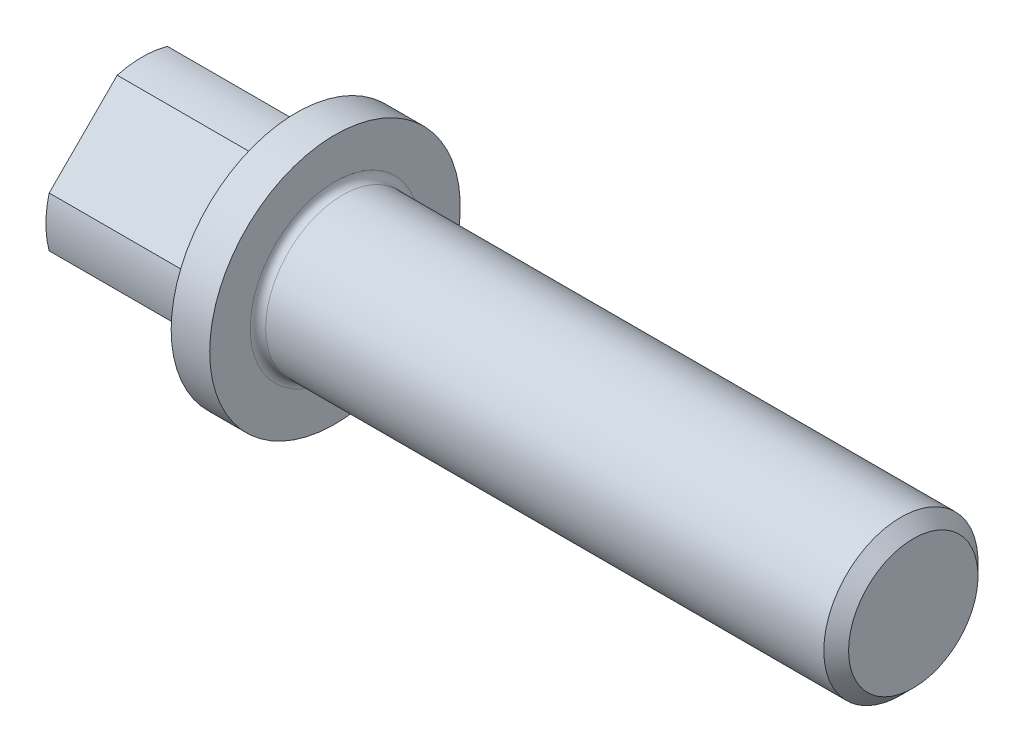
from build123d import *

# Parameters (mm, degrees)
FILLET1_R           = 0.6
FILLET2_R           = 0.6
SQRDRVSKE_OUTSIDE_W = 34.706
SQRDRVSKE_OUTSIDE_H = 34.706
SQUARE_DRIVE_DEPTH  = 12


with BuildPart() as part:
    # BodySke → Base-Revolve (revolve)
    with BuildSketch(Plane.XY):
        Polygon((0, 0), (0, 9.75), (15, 9.75), (15, 6), (59.036, 6), (60, 5.036), (60, 0), align=None)
    revolve(axis=Axis((-31.75, 0, 0), (1, 0, 0)))

    # Fillet1
    fillet1_edges = [part.edges().sort_by_distance(p)[0] for p in [
        (15, -6, 0),
    ]]
    fillet(fillet1_edges, radius=FILLET1_R)

    # Fillet2
    fillet2_edges = [part.edges().sort_by_distance(p)[0] for p in [
        (0, -9.75, 0),
    ]]
    fillet(fillet2_edges, radius=FILLET2_R)

    # SqrDrvSke outside → Square drive (cut)
    with BuildSketch(Plane(origin=(0, 0, 0), x_dir=(0, 0, -1), z_dir=(1, 0, 0))):
        Rectangle(SQRDRVSKE_OUTSIDE_W, SQRDRVSKE_OUTSIDE_H)
        with BuildLine():
            Line((1.950442767, -7.241945389), (7.241945389, -1.950442767))
            ThreePointArc((7.241945389, -1.950442767), (7.5, 0), (7.241945389, 1.950442767))
            Line((7.241945389, 1.950442767), (1.950442767, 7.241945389))
            ThreePointArc((1.950442767, 7.241945389), (0, 7.5), (-1.950442767, 7.241945389))
            Line((-1.950442767, 7.241945389), (-7.241945389, 1.950442767))
            ThreePointArc((-7.241945389, 1.950442767), (-7.5, 0), (-7.241945389, -1.950442767))
            Line((-7.241945389, -1.950442767), (-1.950442767, -7.241945389))
            ThreePointArc((-1.950442767, -7.241945389), (0, -7.5), (1.950442767, -7.241945389))
        make_face(mode=Mode.SUBTRACT)
    extrude(amount=SQUARE_DRIVE_DEPTH, mode=Mode.SUBTRACT)


solid = part.part
